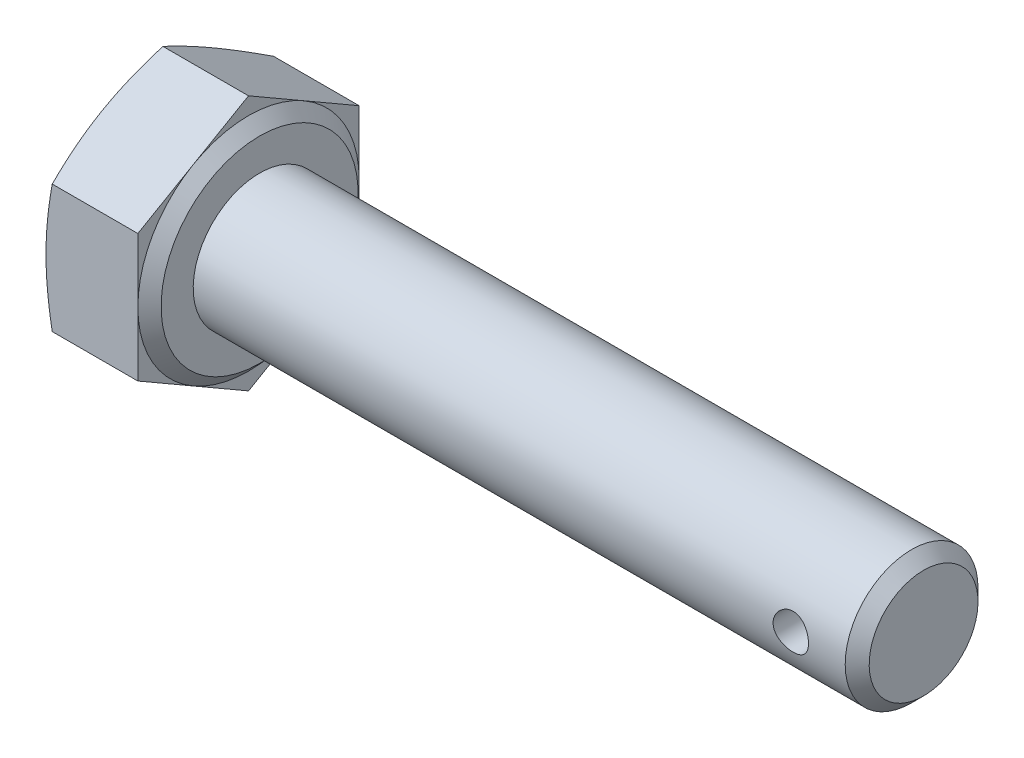
from build123d import *

# Parameters (mm, degrees)
BASEHEAD_DEPTH  = 4.15
SKETCH3_R       = 3
BASEBODY_DEPTH  = 30
CHAMFER1_SIZE   = 0.5415
HOLE_DEPTH      = 36.481767619
HOLE_DEPTH_BACK = 36.481767619
SKETCH5_R       = 0.8


with BuildPart() as part:
    # Sketch-BaseHead → BaseHead (new body)
    with BuildSketch(Plane(origin=(0, 0, 0), x_dir=(0, 0, -1), z_dir=(1, 0, 0))):
        Polygon((0, -5.773502692), (5, -2.886751346), (5, 2.886751346), (0, 5.773502692), (-5, 2.886751346), (-5, -2.886751346), align=None)
    extrude(amount=BASEHEAD_DEPTH)

    # Sketch4 → HeadChamfer (revolve, cut)
    with BuildSketch(Plane(origin=(-0.264637255, -5.916896391, 0), x_dir=(0, 1, 0), z_dir=(0, 0, 1))):
        Polygon((11.690399083, -0.264637255), (10.916896391, -0.264637255), (11.690399083, -0.546169211), align=None)
    revolve(axis=Axis((-4.001564945, 0, 0), (1, 0, 0)), mode=Mode.SUBTRACT)

    # Sketch1 → Revolve1 (revolve)
    with BuildSketch(Plane(origin=(0, 0, 0), x_dir=(1, 0, 0), z_dir=(0, 1, 0))):
        Polygon((4.15, 0), (4.65, 0), (4.65, 4.45), (4.15, 5), align=None)
    revolve(axis=Axis((-4.001564945, 0, 0), (1, 0, 0)))

    # Sketch3 → BaseBody (add)
    with BuildSketch(Plane(origin=(4.65, 0, 0), x_dir=(0, 0, -1), z_dir=(1, 0, 0))):
        Circle(SKETCH3_R)
    extrude(amount=BASEBODY_DEPTH)

    # Chamfer1
    chamfer1_edges = [part.edges().sort_by_distance(p)[0] for p in [
        (34.65, 0, 3),
    ]]
    chamfer(chamfer1_edges, length=CHAMFER1_SIZE)

    # Sketch5 → Hole (cut, two sides: drawn at the far end of the back side and taken through both)
    with BuildSketch(Plane.XY.offset(-HOLE_DEPTH_BACK)):
        with Locations((31.65, 0)):
            Circle(SKETCH5_R)
    extrude(amount=HOLE_DEPTH + HOLE_DEPTH_BACK, mode=Mode.SUBTRACT)


solid = part.part
